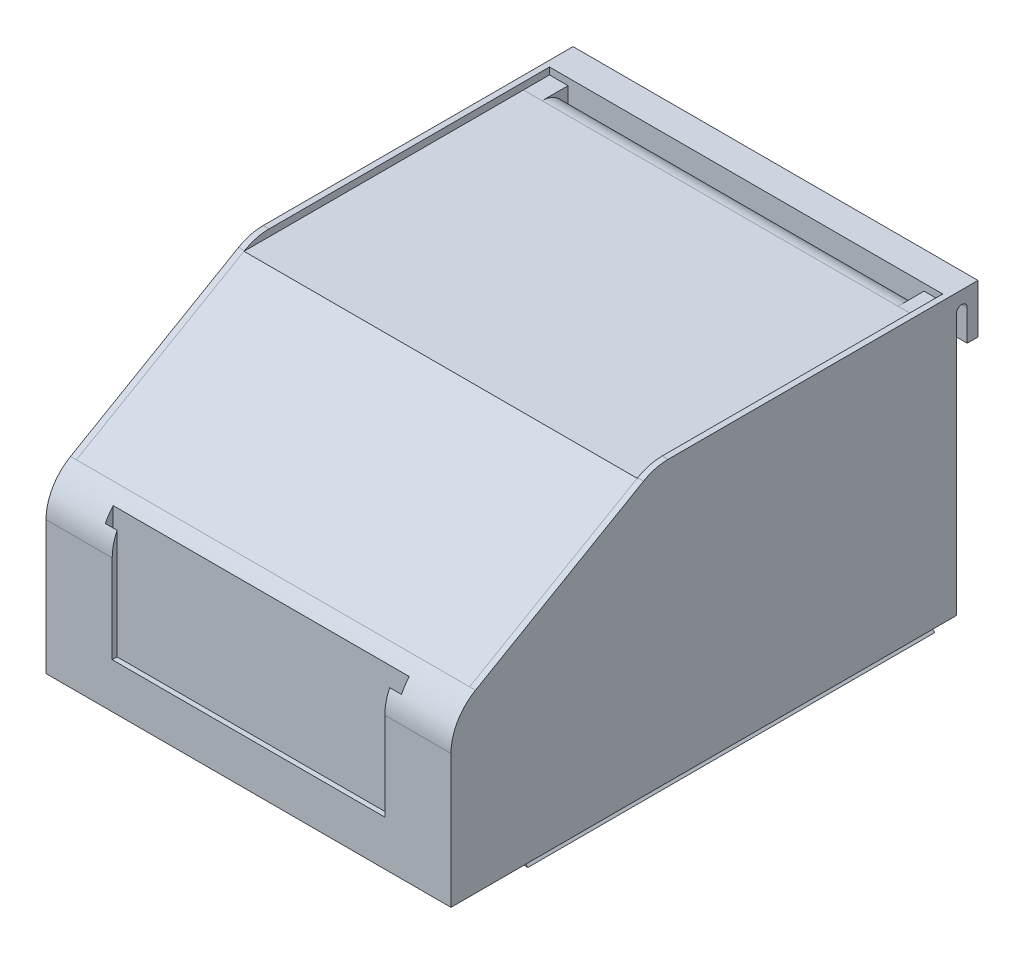
from build123d import *

# Parameters (mm, degrees)
SKETCH1_W                       = 136.525
SKETCH1_H                       = 75.692
BOSS_EXTRUDE1_DEPTH             = 52.451
CUT_EXTRUDE1_DEPTH              = 189.076537859
SKETCH3_W                       = 136.525
SKETCH3_H                       = 3.302
CUT_EXTRUDE2_DEPTH              = 189.076537859
BOSS_EXTRUDE2_START             = 8.89
BOSS_EXTRUDE2_DEPTH             = 105.41
BOSS_EXTRUDE2_2_DEPTH           = 105.41
SKETCH5_W                       = 101.854
SKETCH5_H                       = 128.905
CUT_EXTRUDE3_DEPTH              = 1.778
SKETCH6_W                       = 70.612
SKETCH6_H                       = 58.928
CUT_EXTRUDE4_DEPTH              = 3.302
SKETCH7_W                       = 76.708
SKETCH7_H                       = 61.976
CUT_EXTRUDE5_DEPTH              = 2.032
CUT_EXTRUDE6_DEPTH              = 189.076537859
SPLIT1_SURFACE_1_BACK           = 189.077
SPLIT1_SURFACE_1_DEPTH          = 378.154
SPLIT1_SURFACE_2_BACK           = 189.077
SPLIT1_SURFACE_2_DEPTH          = 378.154
BOSS_EXTRUDE3_REACH             = 166.68
SKETCH12_R                      = 6.35
BOSS_EXTRUDE3_DIRECTION_2_REACH = 166.68
BOSS_EXTRUDE4_DEPTH             = 101.854
CHAMFER1_SIZE                   = 3.048
INTERSECT1_START                = -88.312595624
INTERSECT1_DEPTH                = 106.603527134
INTERSECT1_START_2              = 14.369999962
INTERSECT1_2_DEPTH              = 114.281000039
INTERSECT1_START_3              = -50.927
INTERSECT1_3_OUTLINE_R          = 6.35
INTERSECT1_3_DEPTH              = 101.854
SPLIT4_START                    = -46.101
SPLIT4_DEPTH                    = 98.552
SPLIT4_START_2                  = 46.101
SPLIT4_2_DEPTH                  = 6.35
SPLIT4_START_3                  = 47.879
SPLIT4_3_DEPTH                  = 4.572
SPLIT4_START_4                  = 50.927
SPLIT4_4_OUTLINE_R              = 6.35
SPLIT4_4_DEPTH                  = 1.524
SPLIT4_START_5                  = -88.312595624
SPLIT4_5_DEPTH                  = 106.603527134
SPLIT4_START_6                  = 14.369999962
SPLIT4_6_DEPTH                  = 115.805000039
SPLIT4_START_7                  = 7
SPLIT4_7_OUTLINE_W              = 3.048
SPLIT4_7_OUTLINE_H              = 1.778
SPLIT4_7_DEPTH                  = 8.001344832
BOSS_EXTRUDE5_DEPTH             = 25.4
BOSS_EXTRUDE6_DEPTH             = 25.4
BOSS_EXTRUDE7_START             = -50.927
BOSS_EXTRUDE7_OUTLINE_R         = 6.35
BOSS_EXTRUDE7_DEPTH             = 101.854


with BuildPart() as part:
    # Sketch1 → Boss-Extrude1 (new, symmetric)
    with BuildSketch(Plane(origin=(0, 0, 0), x_dir=(0, 0, -1), z_dir=(1, 0, 0))):
        with Locations((-68.2625, 37.846)):
            Rectangle(SKETCH1_W, SKETCH1_H)
    extrude(amount=BOSS_EXTRUDE1_DEPTH, both=True)

    # Sketch2 → Cut-Extrude1 (cut, through all)
    with BuildSketch(Plane(origin=(52.451, 0, 0), x_dir=(0, 0, -1), z_dir=(1, 0, 0))):
        with BuildLine():
            Line((0, 0), (0, 62.992))
            Line((0, 62.992), (-2.794, 62.992))
            Line((-2.794, 62.992), (-2.794, 70.993))
            ThreePointArc((-2.794, 70.993), (-4.191, 72.39), (-5.588, 70.993))
            Line((-5.588, 70.993), (-5.588, 0))
            Line((-5.588, 0), (0, 0))
        make_face()
    extrude(amount=-CUT_EXTRUDE1_DEPTH, mode=Mode.SUBTRACT)

    # Sketch3 → Cut-Extrude2 (cut, through all)
    with BuildSketch(Plane(origin=(52.451, 0, 0), x_dir=(0, 0, -1), z_dir=(1, 0, 0))):
        with Locations((-68.2625, 1.651)):
            Rectangle(SKETCH3_W, SKETCH3_H)
    extrude(amount=-CUT_EXTRUDE2_DEPTH, mode=Mode.SUBTRACT)

    # Sketch5 → Cut-Extrude3 (cut)
    with BuildSketch(Plane(origin=(0, 75.692, 0), x_dir=(1, 0, 0), z_dir=(0, 1, 0))):
        with Locations((0, -72.0725)):
            Rectangle(SKETCH5_W, SKETCH5_H)
    extrude(amount=-CUT_EXTRUDE3_DEPTH, mode=Mode.SUBTRACT)

    # Sketch6 → Cut-Extrude4 (cut)
    with BuildSketch(Plane.XY.offset(136.525)):
        with Locations((0, 44.45)):
            Rectangle(SKETCH6_W, SKETCH6_H)
    extrude(amount=-CUT_EXTRUDE4_DEPTH, mode=Mode.SUBTRACT)

    # Sketch7 → Cut-Extrude5 (cut)
    with BuildSketch(Plane.XY.offset(133.223)):
        with Locations((0, 42.926)):
            Rectangle(SKETCH7_W, SKETCH7_H)
    extrude(amount=CUT_EXTRUDE5_DEPTH, mode=Mode.SUBTRACT)

    # Sketch8 → Cut-Extrude6 (cut, through all)
    with BuildSketch(Plane(origin=(52.451, 0, 0), x_dir=(0, 0, -1), z_dir=(1, 0, 0))):
        with BuildLine():
            Line((-136.525, 75.692), (-136.525, 37.846))
            ThreePointArc((-136.525, 37.846), (-134.823522628, 44.196), (-130.175, 48.844522628))
            Line((-130.175, 48.844522628), (-86.620850393, 73.990522628))
            ThreePointArc((-86.620850393, 73.990522628), (-83.557852266, 75.259257994), (-80.270850393, 75.692))
            Line((-80.270850393, 75.692), (-136.525, 75.692))
        make_face()
    extrude(amount=-CUT_EXTRUDE6_DEPTH, mode=Mode.SUBTRACT)


with BuildPart() as body_2:
    # Sketch4 → Boss-Extrude2 (new body)
    with BuildSketch(Plane.XY.offset(BOSS_EXTRUDE2_START)):
        Polygon((42.291, 7.874), (42.291, 0), (50.165, 0), align=None)
    extrude(amount=BOSS_EXTRUDE2_DEPTH)


with BuildPart() as body_3:
    # Sketch4 → Boss-Extrude2 2 (new body)
    with BuildSketch(Plane.XY.offset(BOSS_EXTRUDE2_START)):
        Polygon((-42.291, 7.874), (-42.291, 0), (-50.165, 0), align=None)
    extrude(amount=BOSS_EXTRUDE2_2_DEPTH)


with BuildPart() as body_4:
    # Split1: the piece behind the surface
    add(part.part)
    # Split1 surface: a surface, the sketch's curves swept straight by 378.154 mm
    with BuildLine(Plane(origin=(52.451, 0, 0), x_dir=(0, 0, -1), z_dir=(1, 0, 0)).offset(-SPLIT1_SURFACE_1_BACK), mode=Mode.PRIVATE) as split1_surface_1_path:
        Line((-130.175, 75.692), (-7.62, 75.692))
        Line((-7.62, 75.692), (-7.62, 5.334))
        Line((-7.62, 5.334), (-130.175, 5.334))
        Line((-130.175, 5.334), (-130.175, 75.692))
    split1_surface_1 = Shell.extrude(split1_surface_1_path.wire(), (1 * SPLIT1_SURFACE_1_DEPTH, 0 * SPLIT1_SURFACE_1_DEPTH, 0 * SPLIT1_SURFACE_1_DEPTH))
    split(bisect_by=split1_surface_1, keep=Keep.BOTTOM)


with BuildPart() as part_1:
    add(part.part)

    # Split1: split by a surface, the side it looks to stays
    # Split1 surface: a surface, the sketch's curves swept straight by 378.154 mm
    with BuildLine(Plane(origin=(52.451, 0, 0), x_dir=(0, 0, -1), z_dir=(1, 0, 0)).offset(-SPLIT1_SURFACE_2_BACK), mode=Mode.PRIVATE) as split1_surface_2_path:
        Line((-130.175, 75.692), (-7.62, 75.692))
        Line((-7.62, 75.692), (-7.62, 5.334))
        Line((-7.62, 5.334), (-130.175, 5.334))
        Line((-130.175, 5.334), (-130.175, 75.692))
    split1_surface_2 = Shell.extrude(split1_surface_2_path.wire(), (1 * SPLIT1_SURFACE_2_DEPTH, 0 * SPLIT1_SURFACE_2_DEPTH, 0 * SPLIT1_SURFACE_2_DEPTH))
    split(bisect_by=split1_surface_2, keep=Keep.TOP)


with BuildPart() as body_5:

    # Boss-Extrude3: up to this face of the body (flat: up to its plane)
    boss_extrude3_end = Plane(body_4.part.faces().sort_by_distance((50.927, 74.793132551, 46.152790149))[0])
    # Sketch12 → Boss-Extrude3 (new, up to the picked face)
    with BuildSketch(Plane(origin=(0, 0, 0), x_dir=(0, 0, -1), z_dir=(1, 0, 0)), mode=Mode.PRIVATE) as boss_extrude3_sk1:
        with Locations(Location((-14.369999962, 67.564, 0), (0, 0, 180))):
            Circle(SKETCH12_R)
    boss_extrude3_tool1 = split(extrude(boss_extrude3_sk1.sketch, amount=BOSS_EXTRUDE3_REACH, mode=Mode.PRIVATE), bisect_by=boss_extrude3_end, keep=Keep.BOTH, mode=Mode.PRIVATE)
    add(boss_extrude3_tool1.solids().sort_by(Axis((0, 67.564, 14.37), (1, 0, 0)))[0])


    # Boss-Extrude3 direction 2: up to this face of the body (flat: up to its plane)
    boss_extrude3_direction_2_end = Plane(body_4.part.faces().sort_by_distance((-50.927, 74.793132551, 46.152790149))[0])
    # Sketch12 → Boss-Extrude3 direction 2 (add, up to the picked face)
    with BuildSketch(Plane(origin=(0, 0, 0), x_dir=(0, 0, -1), z_dir=(1, 0, 0)), mode=Mode.PRIVATE) as boss_extrude3_direction_2_sk1:
        with Locations(Location((-14.369999962, 67.564, 0), (0, 0, 180))):
            Circle(SKETCH12_R)
    boss_extrude3_direction_2_tool1 = split(extrude(boss_extrude3_direction_2_sk1.sketch, amount=-BOSS_EXTRUDE3_DIRECTION_2_REACH, mode=Mode.PRIVATE), bisect_by=boss_extrude3_direction_2_end, keep=Keep.BOTH, mode=Mode.PRIVATE)
    add(boss_extrude3_direction_2_tool1.solids().sort_by(Axis((0, 67.564, 14.37), (-1, 0, 0)))[0])

    # Sketch13 → Boss-Extrude4 (add)
    with BuildSketch(Plane(origin=(50.927, 0, 0), x_dir=(0, 0, -1), z_dir=(1, 0, 0))):
        Polygon((-14.369999962, 73.914), (-86.753391473, 73.914), (-130.175, 48.844522628), (-128.651, 46.204877197), (-85.936682334, 70.866), (-14.369999962, 70.866), align=None)
    extrude(amount=-BOSS_EXTRUDE4_DEPTH)

    # Chamfer1
    chamfer1_edges = [body_5.edges().sort_by_distance(p)[0] for p in [
        (-50.927, 58.535438599, 107.293841167),
        (-50.927, 70.866, 52.865319024),
        (50.927, 58.535438599, 107.293841167),
        (50.927, 70.866, 52.865319024),
    ]]
    chamfer(chamfer1_edges, length=CHAMFER1_SIZE - 0.0001)  # a hair under: the kernel refuses the full size

    # Sketch15 → Boss-Extrude5 (add, symmetric)
    with BuildSketch(Plane(origin=(0, 0, 0), x_dir=(0, 0, -1), z_dir=(1, 0, 0))):
        Polygon((-128.651, 46.204877197), (-122.37630963, 35.336794674), (-117.669810566, 36.597897298), (-113.179682506, 44.375027231), (-119.313311503, 42.731526294), (-123.151738686, 49.379877197), align=None)
    extrude(amount=BOSS_EXTRUDE5_DEPTH, both=True)


with BuildPart() as body_4_1:
    add(body_4.part)

    # Intersect1: read off the stored shape, not the designer's step
    # Intersect1 outline → Intersect1 (cut)
    with BuildSketch(Plane(origin=(0, 0, 0), x_dir=(1, 0, 0), z_dir=(0, 0.49999999999998085, -0.8660254037844498)).offset(INTERSECT1_START)):
        Polygon((-47.879, -104.340097432), (-50.927, -107.388097432), (50.927, -107.388097432), (47.879, -104.340097432), align=None)
    extrude(amount=INTERSECT1_DEPTH, mode=Mode.SUBTRACT)

    # Intersect1 2 outline → Intersect1 2 (cut)
    with BuildSketch(Plane.XY.offset(INTERSECT1_START_2)):
        Polygon((47.879, 70.866), (50.927, 73.914), (-50.927, 73.914), (-47.879, 70.866), align=None)
    extrude(amount=INTERSECT1_2_DEPTH, mode=Mode.SUBTRACT)

    # Intersect1 3 outline → Intersect1 3 (cut)
    with BuildSketch(Plane.YZ.offset(INTERSECT1_START_3)):
        with Locations((67.564, 14.369999962)):
            Circle(INTERSECT1_3_OUTLINE_R)
    extrude(amount=INTERSECT1_3_DEPTH, mode=Mode.SUBTRACT)

    # Split4: read off the stored shape, not the designer's step
    # Split4 outline → Split4 (cut)
    with BuildSketch(Plane.YZ.offset(SPLIT4_START)):
        with BuildLine():
            Line((5.334, 7.62), (75.692, 7.62))
            Line((75.692, 7.62), (75.692, 80.270850393))
            ThreePointArc((75.692, 80.270850393), (75.259257994, 83.557852266), (73.990522628, 86.620850393))
            Line((73.990522628, 86.620850393), (48.844522628, 130.175))
            Line((48.844522628, 130.175), (5.334, 130.175))
            Line((5.334, 130.175), (5.334, 7.62))
        make_face()
    extrude(amount=SPLIT4_DEPTH, mode=Mode.SUBTRACT)


with BuildPart() as body_6:
    # Split4 2 outline → Split4 2 (new body)
    with BuildSketch(Plane.YZ.offset(SPLIT4_START_2)):
        with BuildLine():
            Line((73.914, 7.62), (73.914, 14.369999962))
            ThreePointArc((73.914, 14.369999962), (62.028198342, 11.259147989), (70.866, 19.793955714))
            Line((70.866, 19.793955714), (70.866, 85.936682334))
            Line((70.866, 85.936682334), (46.204877197, 128.651))
            Line((46.204877197, 128.651), (48.844522628, 130.175))
            Line((48.844522628, 130.175), (5.334, 130.175))
            Line((5.334, 130.175), (5.334, 7.62))
            Line((5.334, 7.62), (73.914, 7.62))
        make_face()
    extrude(amount=SPLIT4_2_DEPTH)

    # Split4 3 outline → Split4 3 (add)
    with BuildSketch(Plane.YZ.offset(SPLIT4_START_3)):
        with BuildLine():
            ThreePointArc((70.866, 19.793955714), (73.099801658, 17.480851935), (73.914, 14.369999962))
            Line((73.914, 14.369999962), (73.914, 7.62))
            Line((73.914, 7.62), (75.692, 7.62))
            Line((75.692, 7.62), (75.692, 80.270850393))
            ThreePointArc((75.692, 80.270850393), (75.259257994, 83.557852266), (73.990522628, 86.620850393))
            Line((73.990522628, 86.620850393), (48.844522628, 130.175))
            Line((48.844522628, 130.175), (46.204877197, 128.651))
            Line((46.204877197, 128.651), (70.866, 85.936682334))
            Line((70.866, 85.936682334), (70.866, 19.793955714))
        make_face()
    extrude(amount=SPLIT4_3_DEPTH)

    # Split4 4 outline → Split4 4 (add)
    with BuildSketch(Plane.YZ.offset(SPLIT4_START_4)):
        with Locations((67.564, 14.369999962)):
            Circle(SPLIT4_4_OUTLINE_R)
    extrude(amount=SPLIT4_4_DEPTH)

    # Split4 5 outline → Split4 5 (cut)
    with BuildSketch(Plane(origin=(0, 0, 0), x_dir=(1, 0, 0), z_dir=(0, 0.49999999999998085, -0.8660254037844498)).offset(SPLIT4_START_5)):
        Polygon((50.927, -107.388097432), (47.879, -104.340097432), (47.879, -107.388097432), align=None)
    extrude(amount=SPLIT4_5_DEPTH, mode=Mode.SUBTRACT)

    # Split4 6 outline → Split4 6 (cut)
    with BuildSketch(Plane.XY.offset(SPLIT4_START_6)):
        Polygon((47.879, 75.692), (47.879, 70.866), (50.927, 73.914), (50.927, 75.692), align=None)
    extrude(amount=SPLIT4_6_DEPTH, mode=Mode.SUBTRACT)

    # Split4 7 outline → Split4 7 (cut)
    with BuildSketch(Plane.XY.offset(SPLIT4_START_7)):
        with Locations((49.403, 74.803)):
            Rectangle(SPLIT4_7_OUTLINE_W, SPLIT4_7_OUTLINE_H)
    extrude(amount=SPLIT4_7_DEPTH, mode=Mode.SUBTRACT)


with BuildPart() as part_2:
    add(part_1.part)

    # Combine1: read off the stored shape, not the designer's step
    # Combine1: union body 4, body 6
    add(body_4_1.part)
    add(body_6.part)


with BuildPart() as body_5_2:
    # Sketch16 → Boss-Extrude6 (new, symmetric)
    with BuildSketch(Plane(origin=(0, 0, 0), x_dir=(0, 0, -1), z_dir=(1, 0, 0))):
        with BuildLine():
            Line((-117.350550224, 43.257446594), (-111.216921227, 44.900947531))
            Line((-111.216921227, 44.900947531), (-112.039585508, 31.195151619))
            ThreePointArc((-112.039585508, 31.195151619), (-117.171136006, 20.6435254), (-106.081455399, 24.476097697))
            Line((-106.081455399, 24.476097697), (-104.350466513, 53.314812271))
            Line((-104.350466513, 53.314812271), (-112.860422163, 51.034576527))
            Line((-112.860422163, 51.034576527), (-117.350550224, 43.257446594))
        make_face()
    extrude(amount=BOSS_EXTRUDE6_DEPTH, both=True)

    # Boss-Extrude7: read off the stored shape, not the designer's step
    # Boss-Extrude7 outline → Boss-Extrude7 (add)
    with BuildSketch(Plane(origin=(0, 0, 0), x_dir=(0, 0, -1), z_dir=(1, 0, 0)).offset(BOSS_EXTRUDE7_START)):
        with Locations((-112.420047414, 24.856559603)):
            Circle(BOSS_EXTRUDE7_OUTLINE_R)
    extrude(amount=BOSS_EXTRUDE7_DEPTH)


solid = Compound([body_2.part, body_3.part, body_5.part, part_2.part, body_5_2.part])
